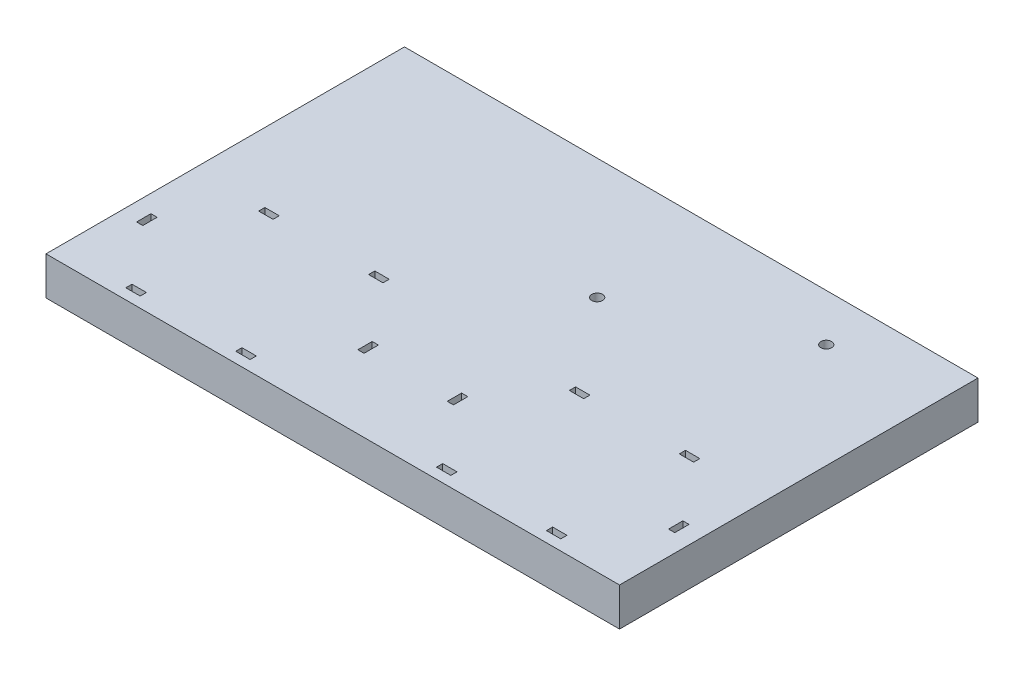
from build123d import *

# Parameters (mm, degrees)
SKETCH1_W           = 120
SKETCH1_H           = 75
SKETCH1_R           = 1.13
SKETCH1_W_2         = 3
SKETCH1_H_2         = 1.3
SKETCH1_W_3         = 1.3
SKETCH1_H_3         = 3
BOSS_EXTRUDE1_DEPTH = 8


with BuildPart() as part:
    # Sketch1 → Boss-Extrude1 (new body)
    with BuildSketch(Plane(origin=(0, 0, 0), x_dir=(1, 0, 0), z_dir=(0, 1, 0))):
        Rectangle(SKETCH1_W, SKETCH1_H)
        with Locations((38.07, 27.68)):
            Circle(SKETCH1_R, mode=Mode.SUBTRACT)
        with Locations((5.56, 12.26)):
            Circle(SKETCH1_R, mode=Mode.SUBTRACT)
        with Locations((21, -34.65)):
            Rectangle(SKETCH1_W_2, SKETCH1_H_2, mode=Mode.SUBTRACT)
        with Locations((21, -6.85)):
            Rectangle(SKETCH1_W_2, SKETCH1_H_2, mode=Mode.SUBTRACT)
        with Locations((44, -6.85)):
            Rectangle(SKETCH1_W_2, SKETCH1_H_2, mode=Mode.SUBTRACT)
        with Locations((44, -34.65)):
            Rectangle(SKETCH1_W_2, SKETCH1_H_2, mode=Mode.SUBTRACT)
        with Locations((55.65, -20.75)):
            Rectangle(SKETCH1_W_3, SKETCH1_H_3, mode=Mode.SUBTRACT)
        with Locations((9.35, -20.75)):
            Rectangle(SKETCH1_W_3, SKETCH1_H_3, mode=Mode.SUBTRACT)
        with Locations((-55.65, -20.75)):
            Rectangle(SKETCH1_W_3, SKETCH1_H_3, mode=Mode.SUBTRACT)
        with Locations((-9.35, -20.75)):
            Rectangle(SKETCH1_W_3, SKETCH1_H_3, mode=Mode.SUBTRACT)
        with Locations((-44, -34.65)):
            Rectangle(SKETCH1_W_2, SKETCH1_H_2, mode=Mode.SUBTRACT)
        with Locations((-44, -6.85)):
            Rectangle(SKETCH1_W_2, SKETCH1_H_2, mode=Mode.SUBTRACT)
        with Locations((-21, -34.65)):
            Rectangle(SKETCH1_W_2, SKETCH1_H_2, mode=Mode.SUBTRACT)
        with Locations((-21, -6.85)):
            Rectangle(SKETCH1_W_2, SKETCH1_H_2, mode=Mode.SUBTRACT)
    extrude(amount=BOSS_EXTRUDE1_DEPTH)


solid = part.part
